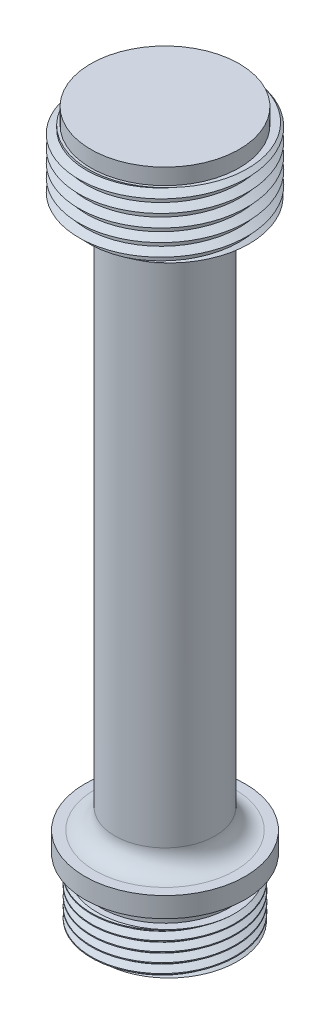
from build123d import *

# Parameters (mm, degrees)
M27_X_2MM_THREAD_PITCH             = 2
M23_X_1_5MM_THREAD_PITCH           = 1.5
F_3_8_0_375_DIAMETER_HOLE1_D       = 9.525
F_3_8_0_375_DIAMETER_HOLE1_DEPTH   = 107.188
F_3_8_0_375_DIAMETER_HOLE1_TIP     = 2.861598698
F_9_16_0_5625_DIAMETER_HOLE1_D     = 14.2875
F_9_16_0_5625_DIAMETER_HOLE1_DEPTH = 9.525
F_9_16_0_5625_DIAMETER_HOLE1_TIP   = 4.292398047
FILLET1_R                          = 3.175


with BuildPart() as part:
    # Sketch1 → Revolve1 (revolve)
    with BuildSketch(Plane.XY, mode=Mode.PRIVATE) as revolve1_sk:
        Polygon((0, 0), (11.75, 0), (11.75, -2.54), (13.481, -2.54), (13.481, -12.7), (7.9375, -12.7), (7.9375, -99.187), (12.7, -99.187), (12.7, -102.362), (10.16, -102.362), (10.16, -104.775), (11.4046, -104.775), (11.4046, -111.887), (0, -111.887), align=None)
    revolve(revolve1_sk.sketch.rotate(Axis((0, 0, 0), (0, 1, 0)), 90), axis=Axis((0, 0, 0), (0, 1, 0)))

    # M27 x 2mm Thread: the profile of Sketch3 screwed along a right-hand helix of 8 turns, 10 arcs to a turn; built about Z, then put on its axis
    m27_x_2mm_thread_z = Axis((0, 0, 0), (0, 0, 1))
    m27_x_2mm_thread_corners = [(12.1305, 0, -0.328512303), (14.1015, 0, -1.466469684), (14.1015, 0, 1.466469684), (12.1305, 0, 0.328512303)]
    with BuildLine(mode=Mode.PRIVATE) as m27_x_2mm_thread_profile:
        Line(m27_x_2mm_thread_corners[0], m27_x_2mm_thread_corners[1])
        Line(m27_x_2mm_thread_corners[1], m27_x_2mm_thread_corners[2])
        Line(m27_x_2mm_thread_corners[2], m27_x_2mm_thread_corners[3])
        Line(m27_x_2mm_thread_corners[3], m27_x_2mm_thread_corners[0])
    m27_x_2mm_thread_cap = Face(m27_x_2mm_thread_profile.wire())
    m27_x_2mm_thread_turn_angles = [0, 18, 36, 54, 72, 90, 108, 126, 144, 162, 180, 198, 216, 234, 252, 270, 288, 306, 324, 342, 360]
    m27_x_2mm_thread_turn_weights = [1, 0.9510565162951535, 1, 0.9510565162951535, 1, 0.9510565162951535, 1, 0.9510565162951535, 1, 0.9510565162951535, 1, 0.9510565162951535, 1, 0.9510565162951535, 1, 0.9510565162951535, 1, 0.9510565162951535, 1, 0.9510565162951535, 1]
    m27_x_2mm_thread_turn_rails = [Edge.make_bspline([Vector(p[0], p[1], 0).rotate(m27_x_2mm_thread_z, m27_x_2mm_thread_turn_angles[k]) / m27_x_2mm_thread_turn_weights[k] + Vector(0, 0, p[2] + M27_X_2MM_THREAD_PITCH * m27_x_2mm_thread_turn_angles[k] / 360) for k in range(21)], [0, 0, 0, 1, 1, 2, 2, 3, 3, 4, 4, 5, 5, 6, 6, 7, 7, 8, 8, 9, 9, 10, 10, 10], 2, m27_x_2mm_thread_turn_weights) for p in m27_x_2mm_thread_corners]
    m27_x_2mm_thread_turn_sides = [Face.make_surface_from_curves(m27_x_2mm_thread_turn_rails[p[0]], m27_x_2mm_thread_turn_rails[p[1]]) for p in [(0, 1), (1, 2), (2, 3), (3, 0)]]
    m27_x_2mm_thread_turn = Solid(Shell([*m27_x_2mm_thread_turn_sides, m27_x_2mm_thread_cap, m27_x_2mm_thread_cap.rotate(m27_x_2mm_thread_z, 360).moved(Location((0, 0, M27_X_2MM_THREAD_PITCH * 360 / 360)))]))
    m27_x_2mm_thread_each = [*[m27_x_2mm_thread_turn.moved(Location((0, 0, M27_X_2MM_THREAD_PITCH * i))) for i in range(8)]]
    add(Plane(origin=(0, 0, 0), x_dir=(1, 0, 0), z_dir=(0, -1, 0)) * Compound([m27_x_2mm_thread_each[i] for i in range(0, 8, 2)]), mode=Mode.SUBTRACT)
    add(Plane(origin=(0, 0, 0), x_dir=(1, 0, 0), z_dir=(0, -1, 0)) * Compound([m27_x_2mm_thread_each[i] for i in range(1, 8, 2)]), mode=Mode.SUBTRACT)

    # M23 x 1.5mm Thread: the profile of Sketch6 screwed along a right-hand helix of 7.25 turns, 8 arcs to a turn; built about Z, then put on its axis
    m23_x_1_5mm_thread_z = Axis((0, 0, 0), (0, 0, 1))
    m23_x_1_5mm_thread_corners = [(10.39858, 0, 0.093750137), (11.5062, 0, 0.733234842), (11.5062, 0, -0.733234842), (10.39858, 0, -0.093750137)]
    with BuildLine(mode=Mode.PRIVATE) as m23_x_1_5mm_thread_profile:
        Line(m23_x_1_5mm_thread_corners[0], m23_x_1_5mm_thread_corners[1])
        Line(m23_x_1_5mm_thread_corners[1], m23_x_1_5mm_thread_corners[2])
        Line(m23_x_1_5mm_thread_corners[2], m23_x_1_5mm_thread_corners[3])
        Line(m23_x_1_5mm_thread_corners[3], m23_x_1_5mm_thread_corners[0])
    m23_x_1_5mm_thread_cap = Face(m23_x_1_5mm_thread_profile.wire())
    m23_x_1_5mm_thread_turn_angles = [0, 22.5, 45, 67.5, 90, 112.5, 135, 157.5, 180, 202.5, 225, 247.5, 270, 292.5, 315, 337.5, 360]
    m23_x_1_5mm_thread_turn_weights = [1, 0.9238795325112867, 1, 0.9238795325112867, 1, 0.9238795325112867, 1, 0.9238795325112867, 1, 0.9238795325112867, 1, 0.9238795325112867, 1, 0.9238795325112867, 1, 0.9238795325112867, 1]
    m23_x_1_5mm_thread_turn_rails = [Edge.make_bspline([Vector(p[0], p[1], 0).rotate(m23_x_1_5mm_thread_z, m23_x_1_5mm_thread_turn_angles[k]) / m23_x_1_5mm_thread_turn_weights[k] + Vector(0, 0, p[2] + M23_X_1_5MM_THREAD_PITCH * m23_x_1_5mm_thread_turn_angles[k] / 360) for k in range(17)], [0, 0, 0, 1, 1, 2, 2, 3, 3, 4, 4, 5, 5, 6, 6, 7, 7, 8, 8, 8], 2, m23_x_1_5mm_thread_turn_weights) for p in m23_x_1_5mm_thread_corners]
    m23_x_1_5mm_thread_turn_sides = [Face.make_surface_from_curves(m23_x_1_5mm_thread_turn_rails[p[0]], m23_x_1_5mm_thread_turn_rails[p[1]]) for p in [(0, 1), (1, 2), (2, 3), (3, 0)]]
    m23_x_1_5mm_thread_last_angles = [2520, 2542.5, 2565, 2587.5, 2610]
    m23_x_1_5mm_thread_last_weights = [1, 0.9238795325112867, 1, 0.9238795325112822, 1]
    m23_x_1_5mm_thread_last_rails = [Edge.make_bspline([Vector(p[0], p[1], 0).rotate(m23_x_1_5mm_thread_z, m23_x_1_5mm_thread_last_angles[k]) / m23_x_1_5mm_thread_last_weights[k] + Vector(0, 0, p[2] + M23_X_1_5MM_THREAD_PITCH * m23_x_1_5mm_thread_last_angles[k] / 360) for k in range(5)], [0, 0, 0, 1, 1, 2, 2, 2], 2, m23_x_1_5mm_thread_last_weights) for p in m23_x_1_5mm_thread_corners]
    m23_x_1_5mm_thread_last_sides = [Face.make_surface_from_curves(m23_x_1_5mm_thread_last_rails[p[0]], m23_x_1_5mm_thread_last_rails[p[1]]) for p in [(0, 1), (1, 2), (2, 3), (3, 0)]]
    m23_x_1_5mm_thread = Plane(origin=(0, -114.427, 0), x_dir=(1, 0, 0), z_dir=(0, 1, 0)) * Solid(Shell([*[p.moved(Location((0, 0, M23_X_1_5MM_THREAD_PITCH * i))) for i in range(7) for p in m23_x_1_5mm_thread_turn_sides], *m23_x_1_5mm_thread_last_sides, m23_x_1_5mm_thread_cap, m23_x_1_5mm_thread_cap.rotate(m23_x_1_5mm_thread_z, 2610).moved(Location((0, 0, M23_X_1_5MM_THREAD_PITCH * 2610 / 360)))]))
    add(m23_x_1_5mm_thread, mode=Mode.SUBTRACT)

    # 3/8 (0.375) Diameter Hole1
    with Locations(Plane(origin=(0, -111.887, 0), x_dir=(-1, 0, 0), z_dir=(0, -1, 0))):
        with Locations((0, 0)):
            Hole(F_3_8_0_375_DIAMETER_HOLE1_D / 2, depth=F_3_8_0_375_DIAMETER_HOLE1_DEPTH)
            with Locations((0, 0, -(F_3_8_0_375_DIAMETER_HOLE1_DEPTH + F_3_8_0_375_DIAMETER_HOLE1_TIP / 2))):  # 118° drill point
                Cone(0, F_3_8_0_375_DIAMETER_HOLE1_D / 2, F_3_8_0_375_DIAMETER_HOLE1_TIP, mode=Mode.SUBTRACT)

    # 9/16 (0.5625) Diameter Hole1
    with Locations(Plane(origin=(0, -111.887, 0), x_dir=(-1, 0, 0), z_dir=(0, -1, 0))):
        with Locations((0, 0)):
            Hole(F_9_16_0_5625_DIAMETER_HOLE1_D / 2, depth=F_9_16_0_5625_DIAMETER_HOLE1_DEPTH)
            with Locations((0, 0, -(F_9_16_0_5625_DIAMETER_HOLE1_DEPTH + F_9_16_0_5625_DIAMETER_HOLE1_TIP / 2))):  # 118° drill point
                Cone(0, F_9_16_0_5625_DIAMETER_HOLE1_D / 2, F_9_16_0_5625_DIAMETER_HOLE1_TIP, mode=Mode.SUBTRACT)

    # Fillet1
    fillet1_edges = [part.edges().sort_by_distance(p)[0] for p in [
        (0, -99.187, 7.9375),
        (0, -12.7, 7.9375),
    ]]
    fillet(fillet1_edges, radius=FILLET1_R)


solid = part.part
